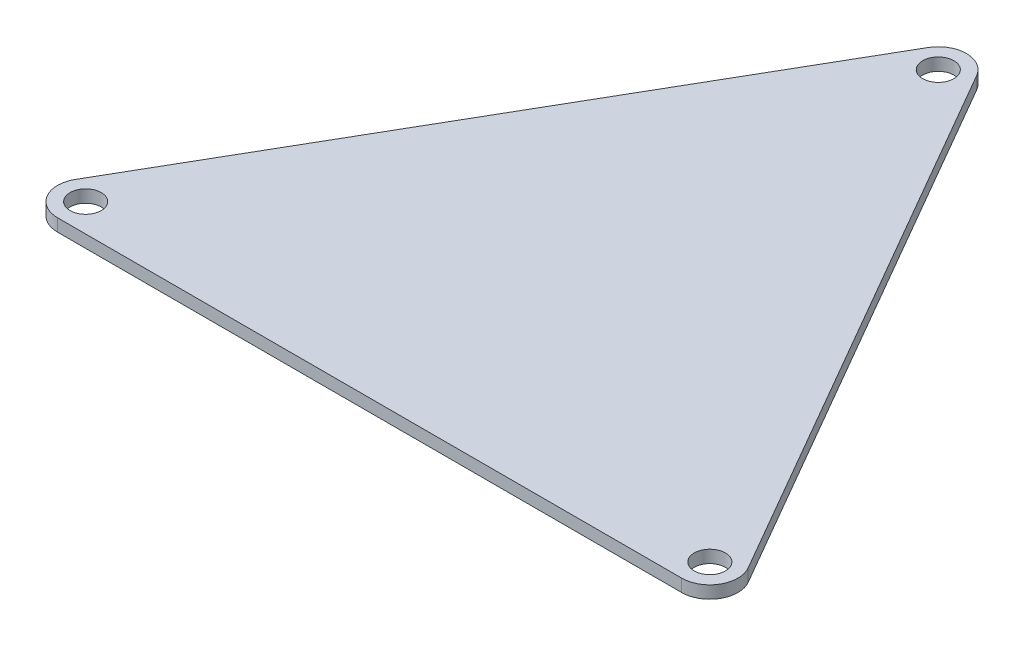
from build123d import *

# Parameters (mm, degrees)
SKETCH1_R           = 2.5
BOSS_EXTRUDE1_DEPTH = 2


with BuildPart() as part:
    # Sketch1 → Boss-Extrude1 (new body)
    with BuildSketch(Plane(origin=(0, 0, 0), x_dir=(1, 0, 0), z_dir=(0, 1, 0))):
        with BuildLine():
            Line((-3.897114317, 59.985026919), (-53.897114317, -26.617513459))
            ThreePointArc((-53.897114317, -26.617513459), (-53.897114317, -31.117513459), (-50, -33.367513459))
            Line((-50, -33.367513459), (50, -33.367513459))
            ThreePointArc((50, -33.367513459), (53.897114317, -31.117513459), (53.897114317, -26.617513459))
            Line((53.897114317, -26.617513459), (3.897114317, 59.985026919))
            ThreePointArc((3.897114317, 59.985026919), (0, 62.235026919), (-3.897114317, 59.985026919))
        make_face()
        with Locations((0, 57.735026919)):
            Circle(SKETCH1_R, mode=Mode.SUBTRACT)
        with Locations((50, -28.867513459)):
            Circle(SKETCH1_R, mode=Mode.SUBTRACT)
        with Locations((-50, -28.867513459)):
            Circle(SKETCH1_R, mode=Mode.SUBTRACT)
    extrude(amount=BOSS_EXTRUDE1_DEPTH)


solid = part.part
